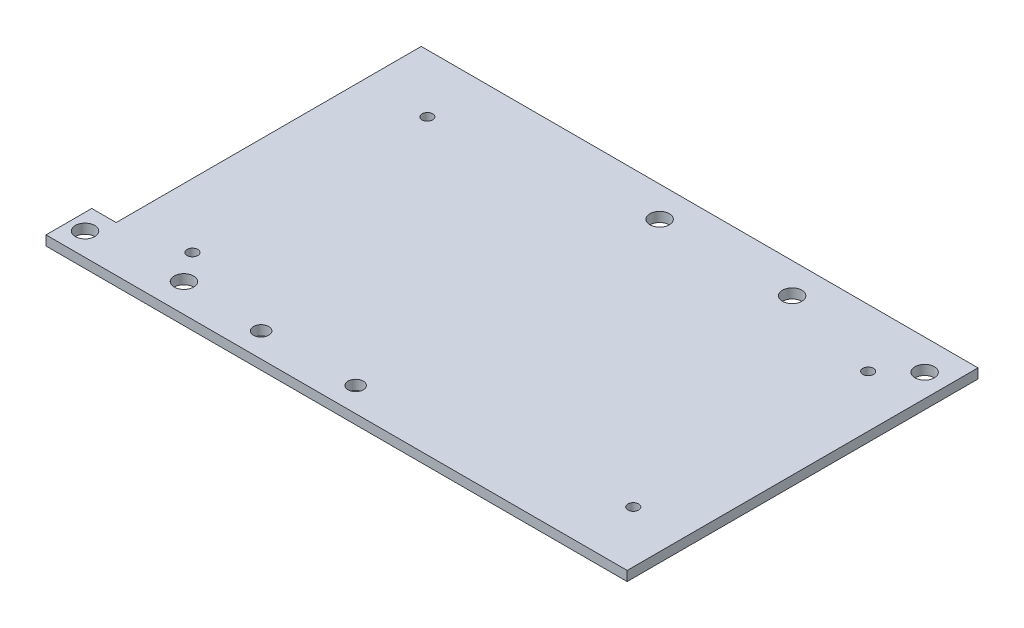
from build123d import *

# Parameters (mm, degrees)
SKETCH1_R           = 6.35
SKETCH1_R_2         = 3.5
SKETCH1_R_3         = 5
BOSS_EXTRUDE1_DEPTH = 6.35


with BuildPart() as part:
    # Sketch1 → Boss-Extrude1 (new body)
    with BuildSketch(Plane(origin=(0, 0, 0), x_dir=(1, 0, 0), z_dir=(0, 1, 0))):
        Polygon((0, 0), (365, 0), (365, -230), (-16, -230), (-16, -200), (0, -200), align=None)
        with Locations((-5.385799986, -215)):
            Circle(SKETCH1_R, mode=Mode.SUBTRACT)
        with Locations((55.701623217, -211.289646053)):
            Circle(SKETCH1_R, mode=Mode.SUBTRACT)
        with Locations((42, -38)):
            Circle(SKETCH1_R_2, mode=Mode.SUBTRACT)
        with Locations((42, -192)):
            Circle(SKETCH1_R_2, mode=Mode.SUBTRACT)
        with Locations((331, -192)):
            Circle(SKETCH1_R_2, mode=Mode.SUBTRACT)
        with Locations((331, -38)):
            Circle(SKETCH1_R_2, mode=Mode.SUBTRACT)
        with Locations((263.133334245, -20)):
            Circle(SKETCH1_R, mode=Mode.SUBTRACT)
        with Locations((171, -214)):
            Circle(SKETCH1_R_3, mode=Mode.SUBTRACT)
        with Locations((109, -214)):
            Circle(SKETCH1_R_3, mode=Mode.SUBTRACT)
        with Locations((176.266668491, -20)):
            Circle(SKETCH1_R, mode=Mode.SUBTRACT)
        with Locations((350, -20)):
            Circle(SKETCH1_R, mode=Mode.SUBTRACT)
    extrude(amount=-BOSS_EXTRUDE1_DEPTH)


solid = part.part
